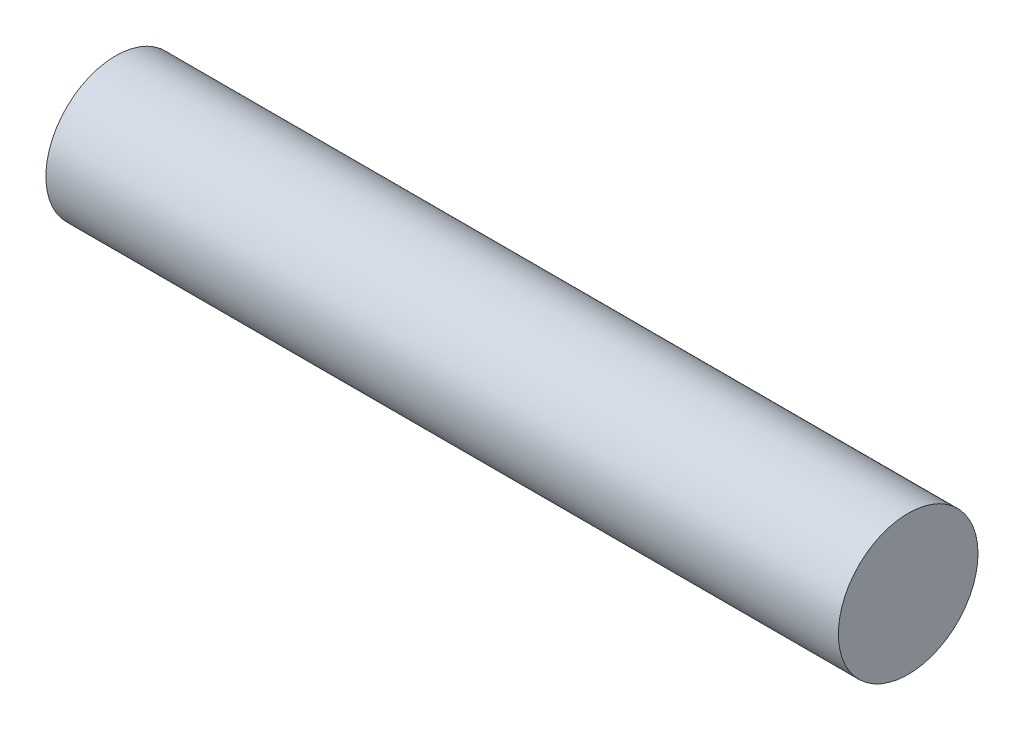
from build123d import *

# Parameters (mm, degrees)
SKETCH1_R           = 13.935202
BOSS_EXTRUDE1_DEPTH = 158.149036


with BuildPart() as part:
    # Sketch1 → Boss-Extrude1 (new body)
    with BuildSketch(Plane(origin=(0, 0, 0), x_dir=(0, 0, -1), z_dir=(1, 0, 0))):
        Circle(SKETCH1_R)
    extrude(amount=-BOSS_EXTRUDE1_DEPTH)


solid = part.part
